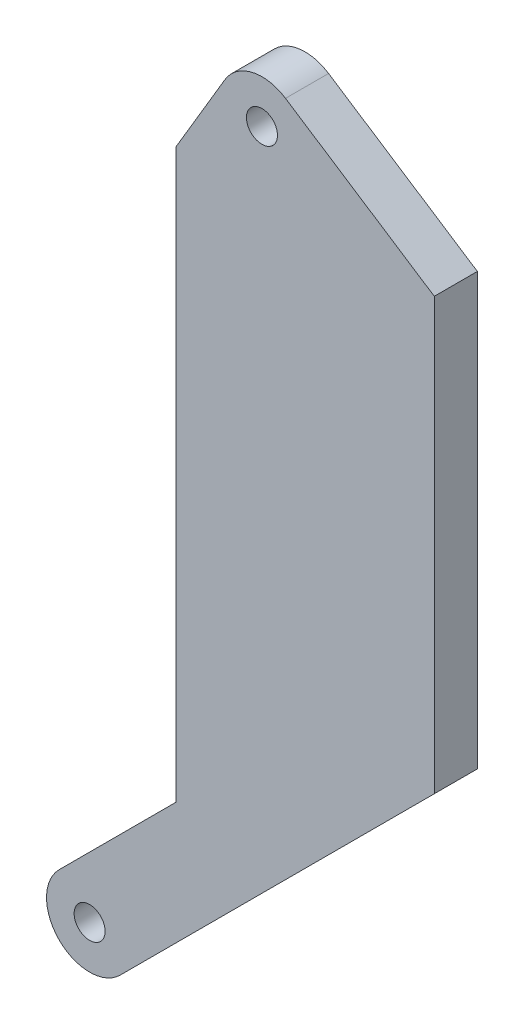
from build123d import *

# Parameters (mm, degrees)
SKETCH1_R           = 2.286
BOSS_EXTRUDE1_DEPTH = 6.35


with BuildPart() as part:
    # Sketch1 → Boss-Extrude1 (new body)
    with BuildSketch(Plane.XY):
        with BuildLine():
            Line((-4.490128061, 4.490128061), (12.7, 21.680256121))
            Line((12.7, 21.680256121), (12.7, 105.319743879))
            Line((12.7, 105.319743879), (19.936589476, 117.536301199))
            ThreePointArc((19.936589476, 117.536301199), (23.957796471, 120.48405603), (28.868141363, 119.619257043))
            Line((28.868141363, 119.619257043), (50.8, 105.319743879))
            Line((50.8, 105.319743879), (50.8, 41.819743879))
            Line((50.8, 41.819743879), (4.490128061, -4.490128061))
            ThreePointArc((4.490128061, -4.490128061), (-4.490128061, -4.490128061), (-4.490128061, 4.490128061))
        make_face()
        Circle(SKETCH1_R, mode=Mode.SUBTRACT)
        with Locations((25.4, 114.3)):
            Circle(SKETCH1_R, mode=Mode.SUBTRACT)
    extrude(amount=BOSS_EXTRUDE1_DEPTH)


solid = part.part
